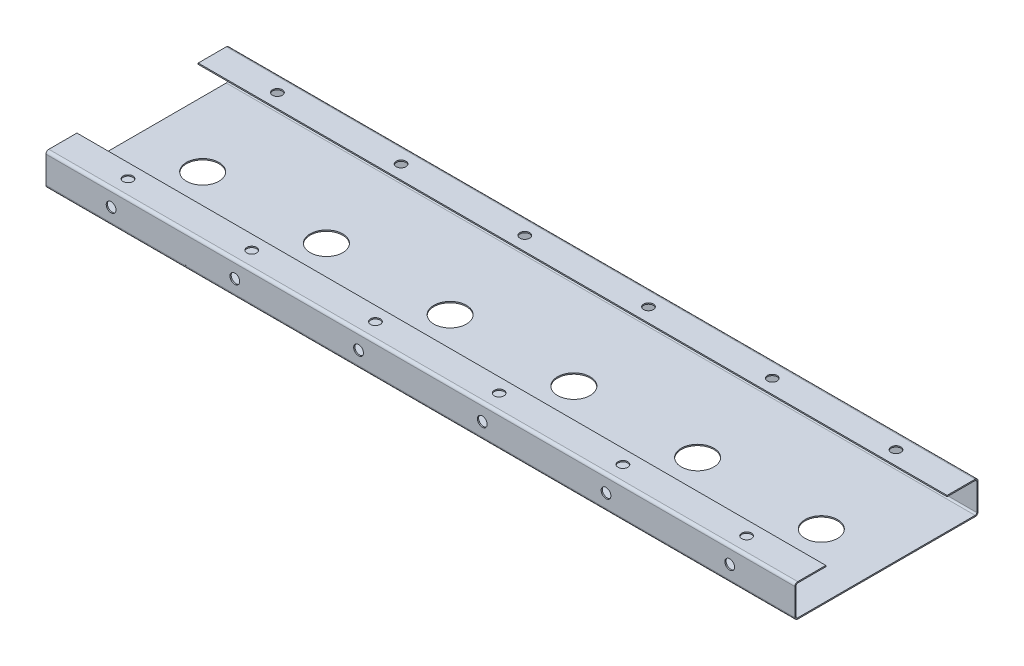
from build123d import *

# Parameters (mm, degrees)
SKETCH1_W                      = 920
SKETCH1_H                      = 225
BASE_FLANGE1_DEPTH             = 1.5
EDGE_FLANGE1_STRIP_W           = 10
EDGE_FLANGE1_STRIP_H           = 1.5
EDGE_FLANGE1_STRIP_CUT_DEPTH   = 920
EDGE_FLANGE1_STRIP_2_W         = 10
EDGE_FLANGE1_STRIP_2_H         = 1.5
EDGE_FLANGE1_STRIP_CUT_2_DEPTH = 920
EDGE_FLANGE1_DEPTH             = 920
EDGE_FLANGE1_BEND_DEPTH        = 920
EDGE_FLANGE2_STRIP_W           = 10
EDGE_FLANGE2_STRIP_H           = 1.5
EDGE_FLANGE2_STRIP_CUT_DEPTH   = 920
EDGE_FLANGE2_STRIP_2_W         = 10
EDGE_FLANGE2_STRIP_2_H         = 1.5
EDGE_FLANGE2_STRIP_CUT_2_DEPTH = 920
EDGE_FLANGE2_DEPTH             = 920
EDGE_FLANGE2_BEND_DEPTH        = 920
SKETCH18_R                     = 6
CUT_EXTRUDE1_DEPTH             = 280
SKETCH19_R                     = 6
CUT_EXTRUDE2_DEPTH             = 5
SKETCH20_R                     = 20
CUT_EXTRUDE3_DEPTH             = 65


# Sheet-metal steps are written as plain solids
with BuildPart() as part:
    # Sketch1 → Base-Flange1 (new body)
    with BuildSketch(Plane(origin=(0, 0, 0), x_dir=(1, 0, 0), z_dir=(0, 1, 0))):
        Rectangle(SKETCH1_W, SKETCH1_H)
    extrude(amount=-BASE_FLANGE1_DEPTH)

    # Edge-Flange1 strip (across the edge) → Edge-Flange1 strip cut (cut)
    with BuildSketch(Plane(origin=(-460, 0, 112.5), x_dir=(0, 0, -1), z_dir=(1, 0, 0))):
        with Locations((-1.5, -0.75)):
            Rectangle(EDGE_FLANGE1_STRIP_W, EDGE_FLANGE1_STRIP_H)
    extrude(amount=EDGE_FLANGE1_STRIP_CUT_DEPTH, mode=Mode.SUBTRACT)

    # Edge-Flange1 strip 2 (across the edge) → Edge-Flange1 strip cut 2 (cut)
    with BuildSketch(Plane(origin=(460, 0, -112.5), x_dir=(0, 0, 1), z_dir=(-1, 0, 0))):
        with Locations((-1.5, -0.75)):
            Rectangle(EDGE_FLANGE1_STRIP_2_W, EDGE_FLANGE1_STRIP_2_H)
    extrude(amount=EDGE_FLANGE1_STRIP_CUT_2_DEPTH, mode=Mode.SUBTRACT)

    # Edge-Flange1 section (across the edge) → Edge-Flange1 (add)
    with BuildSketch(Plane(origin=(-460, 0, 112.5), x_dir=(0, 0, -1), z_dir=(1, 0, 0))):
        with BuildLine():
            Line((0, 2), (0, 38.5))
            Line((0, 38.5), (1.5, 38.5))
            Line((1.5, 38.5), (1.5, 2))
            ThreePointArc((1.5, 2), (2.085786438, 0.585786438), (3.5, 0))
            Line((3.5, 0), (3.5, -1.5))
            ThreePointArc((3.5, -1.5), (1.025126266, -0.474873734), (0, 2))
        make_face()
    extrude(amount=EDGE_FLANGE1_DEPTH)

    # Edge-Flange1 section 2 (across the edge) → Edge-Flange1 bend (add)
    with BuildSketch(Plane(origin=(460, 0, -112.5), x_dir=(0, 0, 1), z_dir=(-1, 0, 0))):
        with BuildLine():
            Line((0, 2), (0, 38.5))
            Line((0, 38.5), (1.5, 38.5))
            Line((1.5, 38.5), (1.5, 2))
            ThreePointArc((1.5, 2), (2.085786438, 0.585786438), (3.5, 0))
            Line((3.5, 0), (3.5, -1.5))
            ThreePointArc((3.5, -1.5), (1.025126266, -0.474873734), (0, 2))
        make_face()
    extrude(amount=EDGE_FLANGE1_BEND_DEPTH)

    # Edge-Flange2 strip (across the edge) → Edge-Flange2 strip cut (cut)
    with BuildSketch(Plane(origin=(-460, 38.5, 111), x_dir=(0, -1, 0), z_dir=(1, 0, 0))):
        with Locations((-1.5, -0.75)):
            Rectangle(EDGE_FLANGE2_STRIP_W, EDGE_FLANGE2_STRIP_H)
    extrude(amount=EDGE_FLANGE2_STRIP_CUT_DEPTH, mode=Mode.SUBTRACT)

    # Edge-Flange2 strip 2 (across the edge) → Edge-Flange2 strip cut 2 (cut)
    with BuildSketch(Plane(origin=(460, 38.5, -111), x_dir=(0, -1, 0), z_dir=(-1, 0, 0))):
        with Locations((-1.5, -0.75)):
            Rectangle(EDGE_FLANGE2_STRIP_2_W, EDGE_FLANGE2_STRIP_2_H)
    extrude(amount=EDGE_FLANGE2_STRIP_CUT_2_DEPTH, mode=Mode.SUBTRACT)

    # Edge-Flange2 section (across the edge) → Edge-Flange2 (add)
    with BuildSketch(Plane(origin=(-460, 38.5, 111), x_dir=(0, -1, 0), z_dir=(1, 0, 0))):
        with BuildLine():
            Line((0, 2), (0, 36.5))
            Line((0, 36.5), (1.5, 36.5))
            Line((1.5, 36.5), (1.5, 2))
            ThreePointArc((1.5, 2), (2.085786438, 0.585786438), (3.5, 0))
            Line((3.5, 0), (3.5, -1.5))
            ThreePointArc((3.5, -1.5), (1.025126266, -0.474873734), (0, 2))
        make_face()
    extrude(amount=EDGE_FLANGE2_DEPTH)

    # Edge-Flange2 section 2 (across the edge) → Edge-Flange2 bend (add)
    with BuildSketch(Plane(origin=(460, 38.5, -111), x_dir=(0, -1, 0), z_dir=(-1, 0, 0))):
        with BuildLine():
            Line((0, 2), (0, 36.5))
            Line((0, 36.5), (1.5, 36.5))
            Line((1.5, 36.5), (1.5, 2))
            ThreePointArc((1.5, 2), (2.085786438, 0.585786438), (3.5, 0))
            Line((3.5, 0), (3.5, -1.5))
            ThreePointArc((3.5, -1.5), (1.025126266, -0.474873734), (0, 2))
        make_face()
    extrude(amount=EDGE_FLANGE2_BEND_DEPTH)

    # Sketch18 → Cut-Extrude1 (cut)
    with BuildSketch(Plane.XY.offset(112.5)):
        with Locations((380, 18.5)):
            Circle(SKETCH18_R)
        with Locations((228, 18.5)):
            Circle(SKETCH18_R)
        with Locations((76, 18.5)):
            Circle(SKETCH18_R)
        with Locations((-76, 18.5)):
            Circle(SKETCH18_R)
        with Locations((-228, 18.5)):
            Circle(SKETCH18_R)
        with Locations((-380, 18.5)):
            Circle(SKETCH18_R)
    extrude(amount=-CUT_EXTRUDE1_DEPTH, mode=Mode.SUBTRACT)

    # Sketch19 → Cut-Extrude2 (cut)
    with BuildSketch(Plane(origin=(0, 38.5, 0), x_dir=(1, 0, 0), z_dir=(0, 1, 0))):
        with Locations(Location((-380, -91.75, 0), (0, 0, 270))):
            Circle(SKETCH19_R)
        with Locations(Location((-228, -91.75, 0), (0, 0, 270))):
            Circle(SKETCH19_R)
        with Locations(Location((-76, -91.75, 0), (0, 0, 270))):
            Circle(SKETCH19_R)
        with Locations(Location((76, -91.75, 0), (0, 0, 270))):
            Circle(SKETCH19_R)
        with Locations(Location((228, -91.75, 0), (0, 0, 270))):
            Circle(SKETCH19_R)
        with Locations(Location((380, -91.75, 0), (0, 0, 270))):
            Circle(SKETCH19_R)
        with Locations(Location((380, 91.75, 0), (0, 0, 90))):
            Circle(SKETCH19_R)
        with Locations(Location((228, 91.75, 0), (0, 0, 90))):
            Circle(SKETCH19_R)
        with Locations(Location((76, 91.75, 0), (0, 0, 90))):
            Circle(SKETCH19_R)
        with Locations(Location((-76, 91.75, 0), (0, 0, 90))):
            Circle(SKETCH19_R)
        with Locations(Location((-228, 91.75, 0), (0, 0, 90))):
            Circle(SKETCH19_R)
        with Locations(Location((-380, 91.75, 0), (0, 0, 90))):
            Circle(SKETCH19_R)
    extrude(amount=-CUT_EXTRUDE2_DEPTH, mode=Mode.SUBTRACT)

    # Sketch20 → Cut-Extrude3 (cut)
    with BuildSketch(Plane(origin=(0, 0, 0), x_dir=(1, 0, 0), z_dir=(0, 1, 0))):
        with Locations(Location((-380, 0, 0), (0, 0, 270))):
            Circle(SKETCH20_R)
        with Locations(Location((-228, 0, 0), (0, 0, 270))):
            Circle(SKETCH20_R)
        with Locations(Location((-76, 0, 0), (0, 0, 270))):
            Circle(SKETCH20_R)
        with Locations(Location((76, 0, 0), (0, 0, 270))):
            Circle(SKETCH20_R)
        with Locations(Location((228, 0, 0), (0, 0, 270))):
            Circle(SKETCH20_R)
        with Locations(Location((380, 0, 0), (0, 0, 270))):
            Circle(SKETCH20_R)
    extrude(amount=-CUT_EXTRUDE3_DEPTH, mode=Mode.SUBTRACT)


solid = part.part
